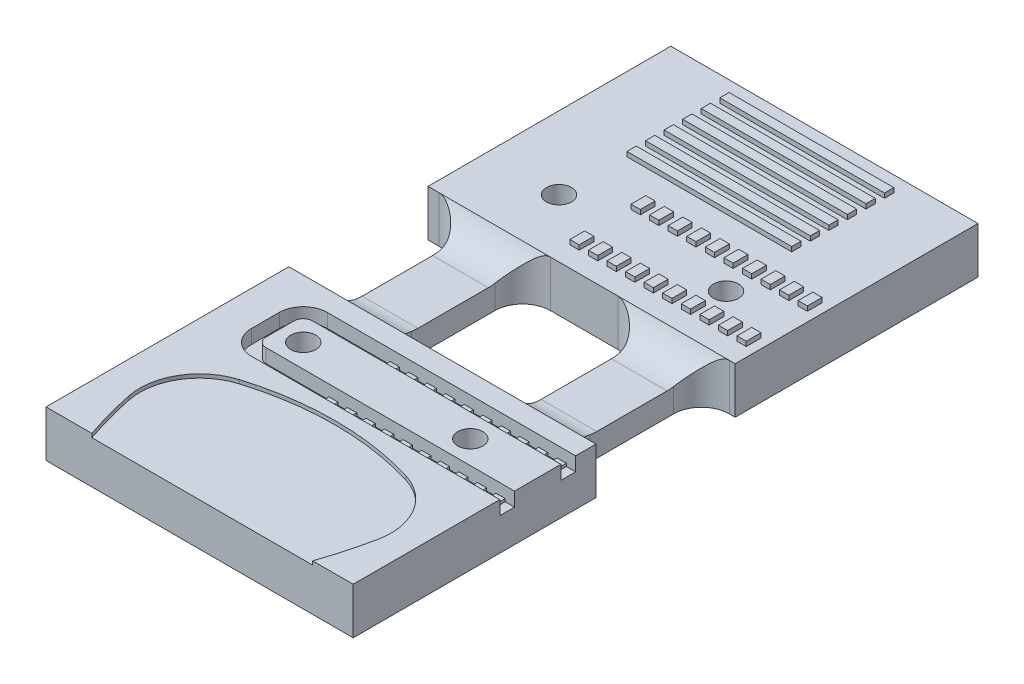
from build123d import *

# Parameters (mm, degrees)
BOSS_EXTRUDE1_DEPTH             = 0.4
BOSS_EXTRUDE4_START             = -0.4
BOSS_EXTRUDE4_DEPTH             = 4.6
CUT_EXTRUDE2_DEPTH              = 1.5
M2_5_CLEARANCE_HOLE1_D          = 2.7
M2_5_CLEARANCE_HOLE1_DEPTH      = 11.188838164
M2_5_CLEARANCE_HOLE1_TIP        = 0.811161836
SKETCH8_W                       = 33.098892865
SKETCH8_H                       = 26.166292271
BOSS_EXTRUDE5_DEPTH             = 5
M2_5_CLEARANCE_HOLE2_AT_2_COUNT = 2
M2_5_CLEARANCE_HOLE2_AT_2_PITCH = 18
SKETCH11_W                      = 1
SKETCH11_H                      = 1.5875
BOSS_EXTRUDE6_DEPTH             = 0.5
LPATTERN1_COUNT                 = 10
LPATTERN1_PITCH                 = 2
BOSS_EXTRUDE7_START             = -1.5
SKETCH11_3_W                    = 1
SKETCH11_3_H                    = 1.5875
BOSS_EXTRUDE7_DEPTH             = 0.3
LPATTERN2_COUNT                 = 10
LPATTERN2_PITCH                 = 2
SKETCH11_4_W                    = 17.754847744
SKETCH11_4_H                    = 1
BOSS_EXTRUDE8_DEPTH             = 0.5
LPATTERN3_COUNT                 = 6
LPATTERN3_PITCH                 = 2
SKETCH12_W                      = 6
SKETCH12_H                      = 15
BOSS_EXTRUDE9_DEPTH             = 2.5
FILLET1_R                       = 3
FILLET2_START                   = -2.5
FILLET2_DEPTH                   = 2.5


with BuildPart() as part:
    # Sketch3 → Boss-Extrude1 (new body)
    with BuildSketch(Plane(origin=(0, 0, 0), x_dir=(1, 0, 0), z_dir=(0, 1, 0))):
        with BuildLine():
            ThreePointArc((-8.964400592, 29.591990842), (0, 30.92), (8.964400592, 29.591990842))
            ThreePointArc((8.964400592, 29.591990842), (12.633049801, 26.719344266), (13.403780114, 22.124014011))
            ThreePointArc((13.403780114, 22.124014011), (12.736333478, 19.347857063), (11.892930693, 16.62))
            Line((11.892930693, 16.62), (16.263283948, 16.62))
            Line((16.263283948, 16.62), (16.263283948, 42.786292272))
            Line((16.263283948, 42.786292272), (-16.835608917, 42.786292272))
            Line((-16.835608917, 42.786292272), (-16.835608917, 16.62))
            Line((-16.835608917, 16.62), (-11.892930693, 16.62))
            ThreePointArc((-11.892930693, 16.62), (-12.736333478, 19.347857063), (-13.403780114, 22.124014011))
            ThreePointArc((-13.403780114, 22.124014011), (-12.633049801, 26.719344266), (-8.964400592, 29.591990842))
        make_face()
        with BuildLine():
            Line((-10.5, 32.42), (16.263283948, 32.42))
            Line((16.263283948, 32.42), (16.263283948, 34.0075))
            Line((16.263283948, 34.0075), (-10.5, 34.0075))
            ThreePointArc((-10.5, 34.0075), (-11.207106781, 34.300393219), (-11.5, 35.0075))
            Line((-11.5, 35.0075), (-11.5, 38.0075))
            ThreePointArc((-11.5, 38.0075), (-11.207106781, 38.714606781), (-10.5, 39.0075))
            Line((-10.5, 39.0075), (16.263283948, 39.0075))
            Line((16.263283948, 39.0075), (16.263283948, 40.595))
            Line((16.263283948, 40.595), (-10.5, 40.595))
            ThreePointArc((-10.5, 40.595), (-12.329638796, 39.837138796), (-13.0875, 38.0075))
            Line((-13.0875, 38.0075), (-13.0875, 35.0075))
            ThreePointArc((-13.0875, 35.0075), (-12.329638796, 33.177861204), (-10.5, 32.42))
        make_face()
        with BuildLine():
            Line((-10.5, 34.0075), (16.263283948, 34.0075))
            Line((16.263283948, 34.0075), (16.263283948, 39.0075))
            Line((16.263283948, 39.0075), (-10.5, 39.0075))
            ThreePointArc((-10.5, 39.0075), (-11.207106781, 38.714606781), (-11.5, 38.0075))
            Line((-11.5, 38.0075), (-11.5, 35.0075))
            ThreePointArc((-11.5, 35.0075), (-11.207106781, 34.300393219), (-10.5, 34.0075))
        make_face()
    extrude(amount=-BOSS_EXTRUDE1_DEPTH)

    # Sketch3<5> → Boss-Extrude4 (add)
    with BuildSketch(Plane(origin=(0, 0, 0), x_dir=(1, 0, 0), z_dir=(0, 1, 0)).offset(BOSS_EXTRUDE4_START)):
        with BuildLine():
            ThreePointArc((-8.964400592, 29.591990842), (0, 30.92), (8.964400592, 29.591990842))
            ThreePointArc((8.964400592, 29.591990842), (12.633049801, 26.719344266), (13.403780114, 22.124014011))
            ThreePointArc((13.403780114, 22.124014011), (12.736333478, 19.347857063), (11.892930693, 16.62))
            Line((11.892930693, 16.62), (16.263283948, 16.62))
            Line((16.263283948, 16.62), (16.263283948, 42.786292272))
            Line((16.263283948, 42.786292272), (-16.835608917, 42.786292272))
            Line((-16.835608917, 42.786292272), (-16.835608917, 16.62))
            Line((-16.835608917, 16.62), (-11.892930693, 16.62))
            ThreePointArc((-11.892930693, 16.62), (-12.736333478, 19.347857063), (-13.403780114, 22.124014011))
            ThreePointArc((-13.403780114, 22.124014011), (-12.633049801, 26.719344266), (-8.964400592, 29.591990842))
        make_face()
        with BuildLine():
            ThreePointArc((8.964400592, 29.591990842), (12.633049801, 26.719344266), (13.403780114, 22.124014011))
            ThreePointArc((13.403780114, 22.124014011), (12.736333478, 19.347857063), (11.892930693, 16.62))
            Line((11.892930693, 16.62), (-11.892930693, 16.62))
            ThreePointArc((-11.892930693, 16.62), (-12.736333478, 19.347857063), (-13.403780114, 22.124014011))
            ThreePointArc((-13.403780114, 22.124014011), (-12.633049801, 26.719344266), (-8.964400592, 29.591990842))
            ThreePointArc((-8.964400592, 29.591990842), (0, 30.92), (8.964400592, 29.591990842))
        make_face()
        with BuildLine():
            Line((-10.5, 32.42), (16.263283948, 32.42))
            Line((16.263283948, 32.42), (16.263283948, 34.0075))
            Line((16.263283948, 34.0075), (-10.5, 34.0075))
            ThreePointArc((-10.5, 34.0075), (-11.207106781, 34.300393219), (-11.5, 35.0075))
            Line((-11.5, 35.0075), (-11.5, 38.0075))
            ThreePointArc((-11.5, 38.0075), (-11.207106781, 38.714606781), (-10.5, 39.0075))
            Line((-10.5, 39.0075), (16.263283948, 39.0075))
            Line((16.263283948, 39.0075), (16.263283948, 40.595))
            Line((16.263283948, 40.595), (-10.5, 40.595))
            ThreePointArc((-10.5, 40.595), (-12.329638796, 39.837138796), (-13.0875, 38.0075))
            Line((-13.0875, 38.0075), (-13.0875, 35.0075))
            ThreePointArc((-13.0875, 35.0075), (-12.329638796, 33.177861204), (-10.5, 32.42))
        make_face()
        with BuildLine():
            Line((-10.5, 34.0075), (16.263283948, 34.0075))
            Line((16.263283948, 34.0075), (16.263283948, 39.0075))
            Line((16.263283948, 39.0075), (-10.5, 39.0075))
            ThreePointArc((-10.5, 39.0075), (-11.207106781, 38.714606781), (-11.5, 38.0075))
            Line((-11.5, 38.0075), (-11.5, 35.0075))
            ThreePointArc((-11.5, 35.0075), (-11.207106781, 34.300393219), (-10.5, 34.0075))
        make_face()
    extrude(amount=-BOSS_EXTRUDE4_DEPTH)

    # Sketch3<7> → Cut-Extrude2 (cut)
    with BuildSketch(Plane(origin=(0, 0, 0), x_dir=(1, 0, 0), z_dir=(0, 1, 0))):
        with BuildLine():
            Line((-10.5, 32.42), (16.263283948, 32.42))
            Line((16.263283948, 32.42), (16.263283948, 34.0075))
            Line((16.263283948, 34.0075), (-10.5, 34.0075))
            ThreePointArc((-10.5, 34.0075), (-11.207106781, 34.300393219), (-11.5, 35.0075))
            Line((-11.5, 35.0075), (-11.5, 38.0075))
            ThreePointArc((-11.5, 38.0075), (-11.207106781, 38.714606781), (-10.5, 39.0075))
            Line((-10.5, 39.0075), (16.263283948, 39.0075))
            Line((16.263283948, 39.0075), (16.263283948, 40.595))
            Line((16.263283948, 40.595), (-10.5, 40.595))
            ThreePointArc((-10.5, 40.595), (-12.329638796, 39.837138796), (-13.0875, 38.0075))
            Line((-13.0875, 38.0075), (-13.0875, 35.0075))
            ThreePointArc((-13.0875, 35.0075), (-12.329638796, 33.177861204), (-10.5, 32.42))
        make_face()
    extrude(amount=-CUT_EXTRUDE2_DEPTH, mode=Mode.SUBTRACT)

    # M2.5 Clearance Hole1
    with Locations(Plane(origin=(0, 0, 0), x_dir=(1, 0, 0), z_dir=(0, 1, 0))):
        with Locations((-9, 36.5075), (9, 36.5075)):
            Hole(M2_5_CLEARANCE_HOLE1_D / 2, depth=M2_5_CLEARANCE_HOLE1_DEPTH)
            with Locations((0, 0, -(M2_5_CLEARANCE_HOLE1_DEPTH + M2_5_CLEARANCE_HOLE1_TIP / 2))):  # 118° drill point
                Cone(0, M2_5_CLEARANCE_HOLE1_D / 2, M2_5_CLEARANCE_HOLE1_TIP, mode=Mode.SUBTRACT)

    # Sketch11<3> → Boss-Extrude7 (add)
    with BuildSketch(Plane(origin=(0, 0, 0), x_dir=(1, 0, 0), z_dir=(0, 1, 0)).offset(BOSS_EXTRUDE7_START)):
        with Locations((14.763283948, 39.80125)):
            Rectangle(SKETCH11_3_W, SKETCH11_3_H)
        with Locations((14.763283948, 33.21375)):
            Rectangle(SKETCH11_3_W, SKETCH11_3_H)
    boss_extrude7 = extrude(amount=BOSS_EXTRUDE7_DEPTH)

    # LPattern2: Boss-Extrude7 ×10
    with Locations(*[(-i * LPATTERN2_PITCH, 0, 0) for i in range(1, LPATTERN2_COUNT)]):
        add(boss_extrude7)



with BuildPart() as body_2:
    # Sketch8 → Boss-Extrude5 (new body)
    with BuildSketch(Plane(origin=(0, 0, 0), x_dir=(1, 0, 0), z_dir=(0, 1, 0))):
        with Locations((-0.286162485, 70.869438407)):
            Rectangle(SKETCH8_W, SKETCH8_H)
    extrude(amount=-BOSS_EXTRUDE5_DEPTH)

    # Sketch10 → M2.5 Clearance Hole2 (revolve, cut)
    with BuildSketch(Plane(origin=(-9, 0, -64.065084543), x_dir=(0, 0, 1), z_dir=(1, 0, 0))):
        Polygon((0, 0), (0, 12), (1.35, 11.188838164), (1.35, 0), align=None)
    m2_5_clearance_hole2 = revolve(axis=Axis((-9, 6.35, -64.065084543), (0, -1, 0)), mode=Mode.SUBTRACT)

    # M2.5 Clearance Hole2 at 2: M2.5 Clearance Hole2 ×2
    with Locations(*[(i * M2_5_CLEARANCE_HOLE2_AT_2_PITCH, 0, 0) for i in range(1, M2_5_CLEARANCE_HOLE2_AT_2_COUNT)]):
        add(m2_5_clearance_hole2, mode=Mode.SUBTRACT)

    # Sketch11 → Boss-Extrude6 (add)
    with BuildSketch(Plane(origin=(0, 0, 0), x_dir=(1, 0, 0), z_dir=(0, 1, 0))):
        with Locations((14.763283948, 67.358834543)):
            Rectangle(SKETCH11_W, SKETCH11_H)
        with Locations((14.763283948, 60.771334543)):
            Rectangle(SKETCH11_W, SKETCH11_H)
    boss_extrude6 = extrude(amount=BOSS_EXTRUDE6_DEPTH)

    # LPattern1: Boss-Extrude6 ×10
    with Locations(*[(-i * LPATTERN1_PITCH, 0, 0) for i in range(1, LPATTERN1_COUNT)]):
        add(boss_extrude6)

    # Sketch11<4> → Boss-Extrude8 (add)
    with BuildSketch(Plane(origin=(0, 0, 0), x_dir=(1, 0, 0), z_dir=(0, 1, 0))):
        with Locations((0, 71.767708748)):
            Rectangle(SKETCH11_4_W, SKETCH11_4_H)
    boss_extrude8 = extrude(amount=BOSS_EXTRUDE8_DEPTH)

    # LPattern3: Boss-Extrude8 ×6
    with Locations(*[(0, 0, -i * LPATTERN3_PITCH) for i in range(1, LPATTERN3_COUNT)]):
        add(boss_extrude8)


with BuildPart() as part_1:
    add(part.part)

    add(body_2.part)  # Boss-Extrude9 merges body 2
    # Sketch12 → Boss-Extrude9 (add)
    with BuildSketch(Plane.XZ.offset(5)):
        with Locations((-9.633596762, -50.286292272)):
            Rectangle(SKETCH12_W, SKETCH12_H)
        with Locations((9.633596762, -50.286292272)):
            Rectangle(SKETCH12_W, SKETCH12_H)
    extrude(amount=-BOSS_EXTRUDE9_DEPTH)

    # Fillet1
    fillet1_edges = [part_1.edges().sort_by_distance(p)[0] for p in [
        (-12.633596762, -3.75, -57.786292272),
        (-12.633596762, -3.75, -42.786292272),
        (-6.633596762, -3.75, -42.786292272),
        (-6.633596762, -3.75, -57.786292272),
        (6.633596762, -3.75, -57.786292272),
        (6.633596762, -3.75, -42.786292272),
        (12.633596762, -3.75, -42.786292272),
        (12.633596762, -3.75, -57.786292272),
    ]]
    fillet(fillet1_edges, radius=FILLET1_R)

    # Fillet2: read off the stored shape, not the designer's step
    # Fillet2 outline → Fillet2 (add)
    with BuildSketch(Plane(origin=(0, 0, 0), x_dir=(1, 0, 0), z_dir=(0, 1, 0)).offset(FILLET2_START)):
        with BuildLine():
            Line((3.633596762, 42.786292272), (15.633596762, 42.786292272))
            ThreePointArc((15.633596762, 42.786292272), (13.512276418, 43.664971928), (12.633596762, 45.786292272))
            Line((12.633596762, 45.786292272), (12.633596762, 54.786292272))
            ThreePointArc((12.633596762, 54.786292272), (13.512276419, 56.907612615), (15.633596762, 57.786292272))
            Line((15.633596762, 57.786292272), (3.633596762, 57.786292272))
            ThreePointArc((3.633596762, 57.786292272), (5.754917105, 56.907612615), (6.633596762, 54.786292272))
            Line((6.633596762, 54.786292272), (6.633596762, 45.786292272))
            ThreePointArc((6.633596762, 45.786292272), (5.754917105, 43.664971928), (3.633596762, 42.786292272))
        make_face()
        with BuildLine():
            Line((-15.633596762, 42.786292272), (-3.633596762, 42.786292272))
            ThreePointArc((-3.633596762, 42.786292272), (-5.754917105, 43.664971928), (-6.633596762, 45.786292272))
            Line((-6.633596762, 45.786292272), (-6.633596762, 54.786292272))
            ThreePointArc((-6.633596762, 54.786292272), (-5.754917105, 56.907612615), (-3.633596762, 57.786292272))
            Line((-3.633596762, 57.786292272), (-15.633596762, 57.786292272))
            ThreePointArc((-15.633596762, 57.786292272), (-13.512276419, 56.907612615), (-12.633596762, 54.786292272))
            Line((-12.633596762, 54.786292272), (-12.633596762, 45.786292272))
            ThreePointArc((-12.633596762, 45.786292272), (-13.512276418, 43.664971928), (-15.633596762, 42.786292272))
        make_face()
    extrude(amount=FILLET2_DEPTH)

    # Fillet2 2: loft between two sections, ruled curve by curve
    fillet2_2_from = [
        Edge.make_three_point_arc((-15.633596762, -2.5, -54.078193028), (-15.633596762, -1.816618124, -56.314270893), (-15.633596762, 2.211e-05, -57.786301215)),
        Edge.make_three_point_arc((-15.633596762, -2.5, -46.494391515), (-15.633596762, -1.816618124, -44.25831365), (-15.633596762, 2.211e-05, -42.786283328)),
        Edge.make_line((-15.633596762, -2.5, -46.494391515), (-15.633596762, -2.5, -54.078193028)),
        Edge.make_line((-15.633596762, 2.211e-05, -42.786283328), (-15.633596762, 2.211e-05, -57.786301215)),
    ]
    fillet2_2_to = [
        Edge.make_three_point_arc((-3.633596762, -2.5, -54.078193028), (-3.633596762, -1.816618124, -56.314270893), (-3.633596762, 2.211e-05, -57.786301215)),
        Edge.make_three_point_arc((-3.633596762, -2.5, -46.494391515), (-3.633596762, -1.816618124, -44.25831365), (-3.633596762, 2.211e-05, -42.786283328)),
        Edge.make_line((-3.633596762, -2.5, -46.494391515), (-3.633596762, -2.5, -54.078193028)),
        Edge.make_line((-3.633596762, 2.211e-05, -42.786283328), (-3.633596762, 2.211e-05, -57.786301215)),
    ]
    fillet2_2 = Solid(Shell([*[Face.make_surface_from_curves(fillet2_2_from[k], fillet2_2_to[k]) for k in range(4)], Face(Wire(fillet2_2_from)), Face(Wire(fillet2_2_to))]))
    add(fillet2_2, mode=Mode.SUBTRACT)

    # Fillet2 3: loft between two sections, ruled curve by curve
    fillet2_3_from = [
        Edge.make_three_point_arc((3.633596762, -2.5, -54.078193028), (3.633596762, -1.816618124, -56.314270893), (3.633596762, 2.211e-05, -57.786301215)),
        Edge.make_three_point_arc((3.633596762, -2.5, -46.494391515), (3.633596762, -1.816618124, -44.25831365), (3.633596762, 2.211e-05, -42.786283328)),
        Edge.make_line((3.633596762, -2.5, -46.494391515), (3.633596762, -2.5, -54.078193028)),
        Edge.make_line((3.633596762, 2.211e-05, -42.786283328), (3.633596762, 2.211e-05, -57.786301215)),
    ]
    fillet2_3_to = [
        Edge.make_three_point_arc((15.633596762, -2.5, -54.078193028), (15.633596762, -1.816618124, -56.314270893), (15.633596762, 2.211e-05, -57.786301215)),
        Edge.make_three_point_arc((15.633596762, -2.5, -46.494391515), (15.633596762, -1.816618124, -44.25831365), (15.633596762, 2.211e-05, -42.786283328)),
        Edge.make_line((15.633596762, -2.5, -46.494391515), (15.633596762, -2.5, -54.078193028)),
        Edge.make_line((15.633596762, 2.211e-05, -42.786283328), (15.633596762, 2.211e-05, -57.786301215)),
    ]
    fillet2_3 = Solid(Shell([*[Face.make_surface_from_curves(fillet2_3_from[k], fillet2_3_to[k]) for k in range(4)], Face(Wire(fillet2_3_from)), Face(Wire(fillet2_3_to))]))
    add(fillet2_3, mode=Mode.SUBTRACT)


solid = part_1.part
